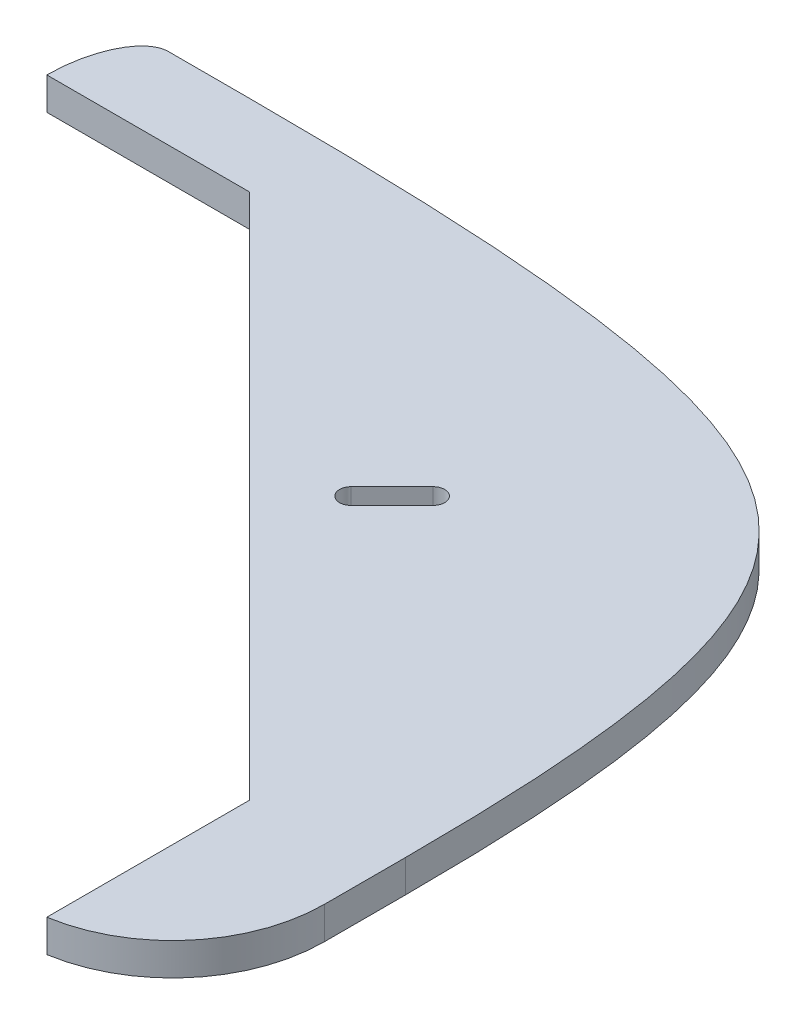
from build123d import *

# Parameters (mm, degrees)
BOSS_EXTRUDE1_DEPTH = 5.08
SKETCH2_W           = 12.7
SKETCH2_H           = 5.08
BOSS_EXTRUDE2_DEPTH = 6.35
FILLET3_SIZE        = 6.35
FILLET3_SIZE_2      = 12.7
BOSS_EXTRUDE3_START = -5.08
BOSS_EXTRUDE3_DEPTH = 5.08


with BuildPart() as part:
    # Sketch1 → Boss-Extrude1 (new body)
    with BuildSketch(Plane(origin=(0, 0, 0), x_dir=(1, 0, 0), z_dir=(0, 1, 0))):
        with BuildLine():
            Line((0, 120.65), (12.7, 120.65))
            ThreePointArc((12.7, 120.65), (89.032177029, 89.032177029), (120.65, 12.7))
            Line((120.65, 12.7), (120.65, 0))
            Line((120.65, 0), (107.95, 0))
            Line((107.95, 0), (107.95, 25.4))
            Line((107.95, 25.4), (25.4, 107.95))
            Line((25.4, 107.95), (0, 107.95))
            Line((0, 107.95), (0, 120.65))
        make_face()
        with BuildLine():
            Line((73.363460454, 75.909044866), (79.798132163, 82.343716575))
            ThreePointArc((79.798132163, 82.343716575), (82.343716575, 82.343716575), (82.343716575, 79.798132163))
            Line((82.343716575, 79.798132163), (75.909044866, 73.363460454))
            ThreePointArc((75.909044866, 73.363460454), (73.363460454, 73.363460454), (73.363460454, 75.909044866))
        make_face(mode=Mode.SUBTRACT)
    extrude(amount=BOSS_EXTRUDE1_DEPTH)

    # Sketch2 → Boss-Extrude2 (add)
    with BuildSketch(Plane.ZY):
        with Locations((-114.3, 2.54)):
            Rectangle(SKETCH2_W, SKETCH2_H)
    extrude(amount=BOSS_EXTRUDE2_DEPTH)

    # Fillet3
    # an asymmetric fillet: 12.7, 6.35 mm, written as the material it takes off along each edge
    with BuildSketch(Plane(origin=(-6.35, 36.83, -120.65), x_dir=(1, 0, 0), z_dir=(0, -1, 0))) as fillet3_piece_1:
        with BuildLine():
            Bezier((FILLET3_SIZE, 0), (0, 0), (0, FILLET3_SIZE_2), weights=[1, 0.707106781, 1])
            Line((0, FILLET3_SIZE_2), (0, 0))
            Line((0, 0), (FILLET3_SIZE, 0))
        make_face()
    extrude(amount=68.58, mode=Mode.SUBTRACT)

    # Sketch3 → Boss-Extrude3 (add)
    with BuildSketch(Plane(origin=(0, 5.08, 0), x_dir=(1, 0, 0), z_dir=(0, 1, 0)).offset(BOSS_EXTRUDE3_START)):
        with BuildLine():
            ThreePointArc((12.7, 120.65), (68.239816798, 105.266361331), (107.95, 63.5))
            Line((107.95, 63.5), (107.95, 104.894556371))
            add(Edge.make_bspline(
                [(107.95, 104.894556371), (87.95, 120.65), (12.7, 120.65)],
                knots=[0.5, 0.5, 0.5, 1, 1, 1], degree=2, weights=[1.440625, 1.440625, 1]))
        make_face()
        with BuildLine():
            Line((120.65, 12.7), (120.65, 0))
            ThreePointArc((120.65, 0), (126.049146067, 7.835495184), (127.95, 17.159256086))
            Line((127.95, 17.159256086), (127.95, 29.859256086))
            add(Edge.make_bspline(
                [(127.95, 29.859256086), (127.95, 89.139112741), (107.95, 104.894556371)],
                knots=[0, 0, 0, 0.5, 0.5, 0.5], degree=2, weights=[1, 1.440625, 1.440625]))
            Line((107.95, 104.894556371), (107.95, 63.5))
            ThreePointArc((107.95, 63.5), (117.426882891, 38.881720723), (120.65, 12.7))
        make_face()
        with BuildLine():
            Line((120.65, 0), (107.95, 0))
            Line((107.95, 0), (107.95, -6.35))
            ThreePointArc((107.95, -6.35), (114.784215424, -4.143430847), (120.65, 0))
        make_face()
    extrude(amount=BOSS_EXTRUDE3_DEPTH)


solid = part.part
